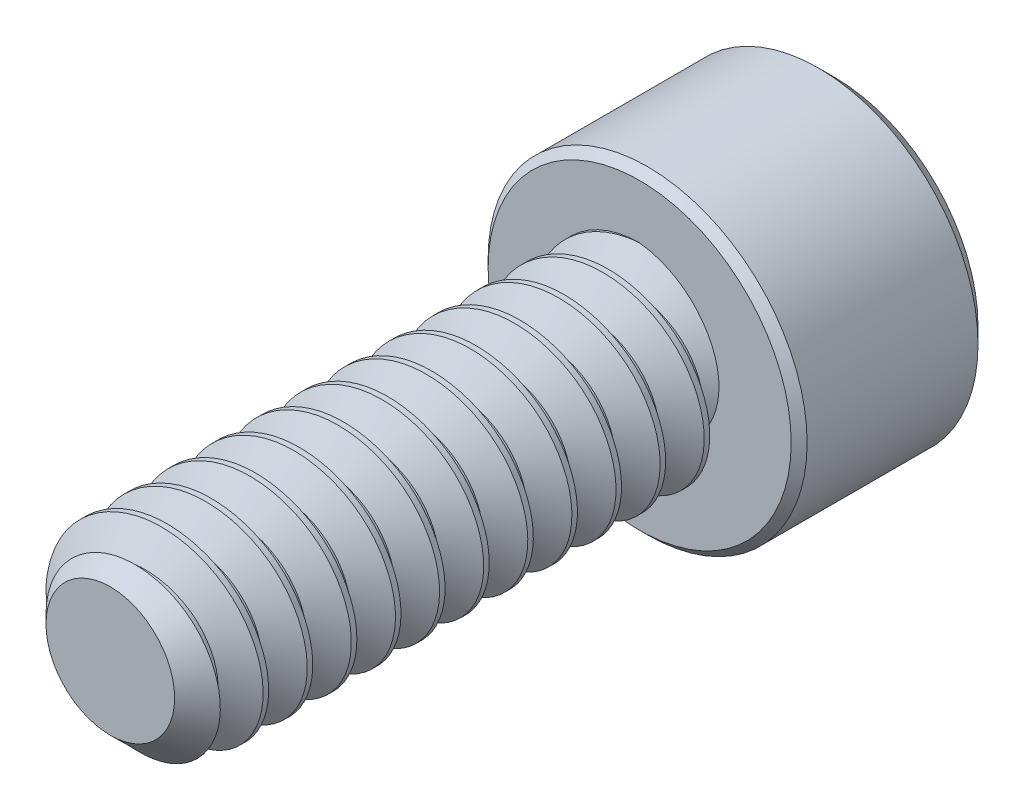
from build123d import *

# Parameters (mm, degrees)
SKETCH1_R          = 1.7526
EXTRUDE1_DEPTH     = 9.525
CHAMFER3_SIZE      = 0.5953125
CUT_SWEEP1_PITCH   = 0.79375
SKETCH6_R          = 2.8702
EXTRUDE2_DEPTH     = 3.5052
CUT_EXTRUDE1_DEPTH = 2.08359375
CHAMFER1_SIZE      = 0.28702
CHAMFER2_SIZE      = 0.14351


with BuildPart() as part:
    # Sketch1 → Extrude1 (new body)
    with BuildSketch(Plane.XY):
        Circle(SKETCH1_R)
    extrude(amount=-EXTRUDE1_DEPTH)

    # Chamfer3
    chamfer3_edges = [part.edges().sort_by_distance(p)[0] for p in [
        (-1.7526, 0, 0),
    ]]
    chamfer(chamfer3_edges, length=CHAMFER3_SIZE)

    # Cut-Sweep1: the profile of Sketch3 profile screwed along a right-hand helix of 13 turns, 6 arcs to a turn; built about Z, then put on its axis
    cut_sweep1_z = Axis((0, 0, 0), (0, 0, 1))
    cut_sweep1_corners = [(1.7529, 0, -0.694704455), (1.237044252, 0, -0.396875), (1.237044252, 0, -0.29765625), (1.7529, 0, 0.000173205)]
    with BuildLine(mode=Mode.PRIVATE) as cut_sweep1_profile:
        Line(cut_sweep1_corners[0], cut_sweep1_corners[1])
        Line(cut_sweep1_corners[1], cut_sweep1_corners[2])
        Line(cut_sweep1_corners[2], cut_sweep1_corners[3])
        Line(cut_sweep1_corners[3], cut_sweep1_corners[0])
    cut_sweep1_cap = Face(cut_sweep1_profile.wire())
    cut_sweep1_turn_angles = [0, 30, 60, 90, 120, 150, 180, 210, 240, 270, 300, 330, 360]
    cut_sweep1_turn_weights = [1, 0.8660254037844387, 1, 0.8660254037844387, 1, 0.8660254037844387, 1, 0.8660254037844387, 1, 0.8660254037844387, 1, 0.8660254037844387, 1]
    cut_sweep1_turn_rails = [Edge.make_bspline([Vector(p[0], p[1], 0).rotate(cut_sweep1_z, cut_sweep1_turn_angles[k]) / cut_sweep1_turn_weights[k] + Vector(0, 0, p[2] + CUT_SWEEP1_PITCH * cut_sweep1_turn_angles[k] / 360) for k in range(13)], [0, 0, 0, 1, 1, 2, 2, 3, 3, 4, 4, 5, 5, 6, 6, 6], 2, cut_sweep1_turn_weights) for p in cut_sweep1_corners]
    cut_sweep1_turn_sides = [Face.make_surface_from_curves(cut_sweep1_turn_rails[p[0]], cut_sweep1_turn_rails[p[1]]) for p in [(0, 1), (1, 2), (2, 3), (3, 0)]]
    cut_sweep1 = Plane(origin=(0, 0, 0), x_dir=(0, 1, 0), z_dir=(0, 0, -1)) * Solid(Shell([*[p.moved(Location((0, 0, CUT_SWEEP1_PITCH * i))) for i in range(13) for p in cut_sweep1_turn_sides], cut_sweep1_cap, cut_sweep1_cap.rotate(cut_sweep1_z, 4680).moved(Location((0, 0, CUT_SWEEP1_PITCH * 4680 / 360)))]))
    add(cut_sweep1, mode=Mode.SUBTRACT)

    # Sketch6 → Extrude2 (add)
    with BuildSketch(Plane(origin=(0, 0, -9.525), x_dir=(-1, 0, 0), z_dir=(0, 0, -1))):
        Circle(SKETCH6_R)
    extrude(amount=EXTRUDE2_DEPTH)

    # Sketch7 → Cut-Extrude1 (cut)
    with BuildSketch(Plane(origin=(0, 0, -13.0302), x_dir=(-1, 0, 0), z_dir=(0, 0, -1))):
        Polygon((0, 1.603951217), (-1.3890625, 0.801975608), (-1.3890625, -0.801975608), (0, -1.603951217), (1.3890625, -0.801975608), (1.3890625, 0.801975608), align=None)
    extrude(amount=-CUT_EXTRUDE1_DEPTH, mode=Mode.SUBTRACT)

    # Cut-Extrude2 cone 1 section (through the dimple's axis) → Cut-Extrude2 (revolve, cut)
    with BuildSketch(Plane(origin=(0, 0, -13.0302), x_dir=(0, 1, 0), z_dir=(1, 0, 0))):
        Polygon((0, 0), (1.603951217, 0), (0, 1.603951217), align=None)
    revolve(axis=Axis((0, 0, -13.0302), (0, 0, 1)), mode=Mode.SUBTRACT)

    # Chamfer1
    chamfer1_edges = [part.edges().sort_by_distance(p)[0] for p in [
        (2.8702, 0, -13.0302),
    ]]
    chamfer(chamfer1_edges, length=CHAMFER1_SIZE)

    # Chamfer2
    chamfer2_edges = [part.edges().sort_by_distance(p)[0] for p in [
        (2.8702, 0, -9.525),
    ]]
    chamfer(chamfer2_edges, length=CHAMFER2_SIZE)


solid = part.part
